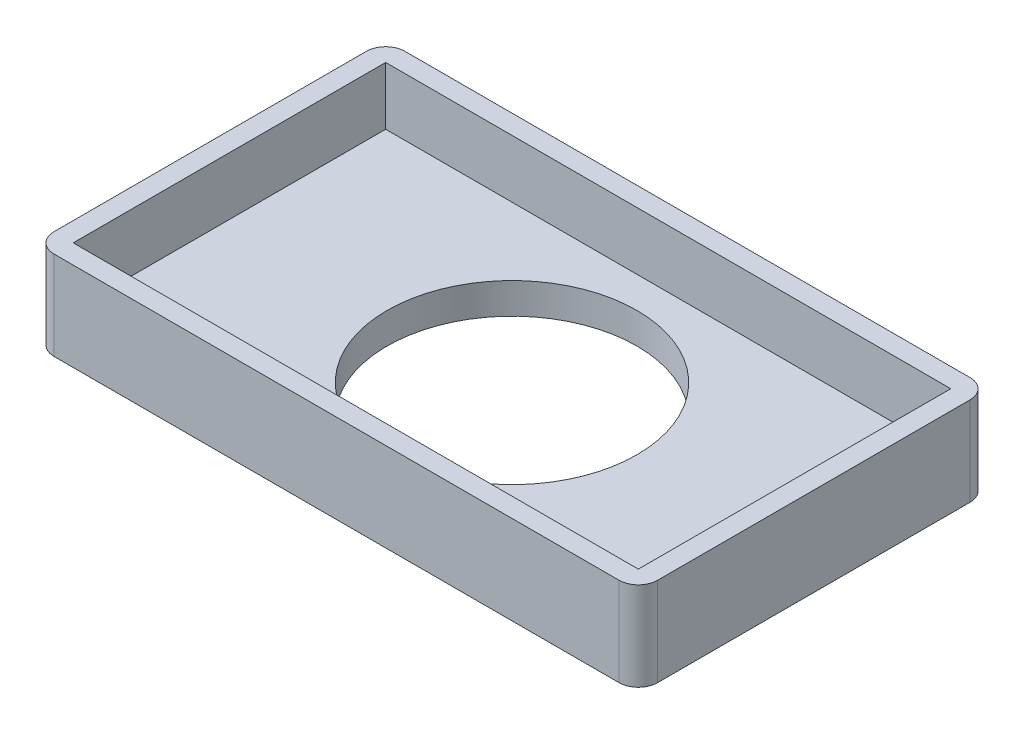
from build123d import *

# Parameters (mm, degrees)
SKETCH1_W           = 156.5
SKETCH1_H           = 91
BOSS_EXTRUDE1_DEPTH = 8
SKETCH2_W           = 156.5
SKETCH2_H           = 91
SKETCH2_W_2         = 146.5
SKETCH2_H_2         = 81
BOSS_EXTRUDE2_DEPTH = 15
SKETCH3_R           = 32.4
CUT_EXTRUDE1_DEPTH  = 94.393321496
FILLET1_R           = 5
FILLET2_R           = 5


with BuildPart() as part:
    # Sketch1 → Boss-Extrude1 (new body)
    with BuildSketch(Plane(origin=(0, 0, 0), x_dir=(1, 0, 0), z_dir=(0, 1, 0))):
        Rectangle(SKETCH1_W, SKETCH1_H)
    extrude(amount=BOSS_EXTRUDE1_DEPTH)

    # Sketch2 → Boss-Extrude2 (add)
    with BuildSketch(Plane(origin=(0, 8, 0), x_dir=(1, 0, 0), z_dir=(0, 1, 0))):
        Rectangle(SKETCH2_W, SKETCH2_H)
        Rectangle(SKETCH2_W_2, SKETCH2_H_2, mode=Mode.SUBTRACT)
    extrude(amount=BOSS_EXTRUDE2_DEPTH)

    # Sketch3 → Cut-Extrude1 (cut, through all)
    with BuildSketch(Plane.XZ):
        Circle(SKETCH3_R)
    extrude(amount=-CUT_EXTRUDE1_DEPTH, mode=Mode.SUBTRACT)

    # Fillet1
    fillet1_edges = [part.edges().sort_by_distance(p)[0] for p in [
        (-78.25, 11.5, 45.5),
    ]]
    fillet(fillet1_edges, radius=FILLET1_R)

    # Fillet2
    fillet2_edges = [part.edges().sort_by_distance(p)[0] for p in [
        (78.25, 11.5, 45.5),
        (78.25, 11.5, -45.5),
        (-78.25, 11.5, -45.5),
    ]]
    fillet(fillet2_edges, radius=FILLET2_R)


solid = part.part
